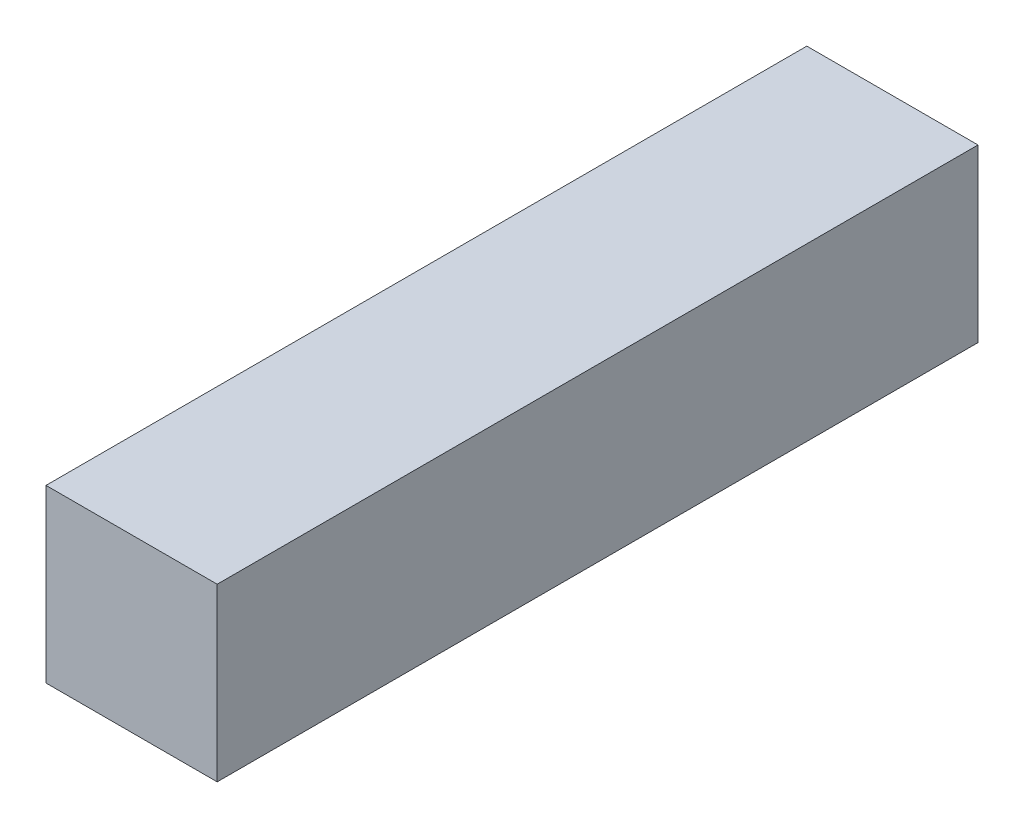
from build123d import *

# Parameters (mm, degrees)
SKETCH1_W           = 4.5
SKETCH1_H           = 4.5
BOSS_EXTRUDE1_DEPTH = 20


with BuildPart() as part:
    # Sketch1 → Boss-Extrude1 (new body)
    with BuildSketch(Plane.XY):
        Rectangle(SKETCH1_W, SKETCH1_H)
    extrude(amount=BOSS_EXTRUDE1_DEPTH)


solid = part.part
